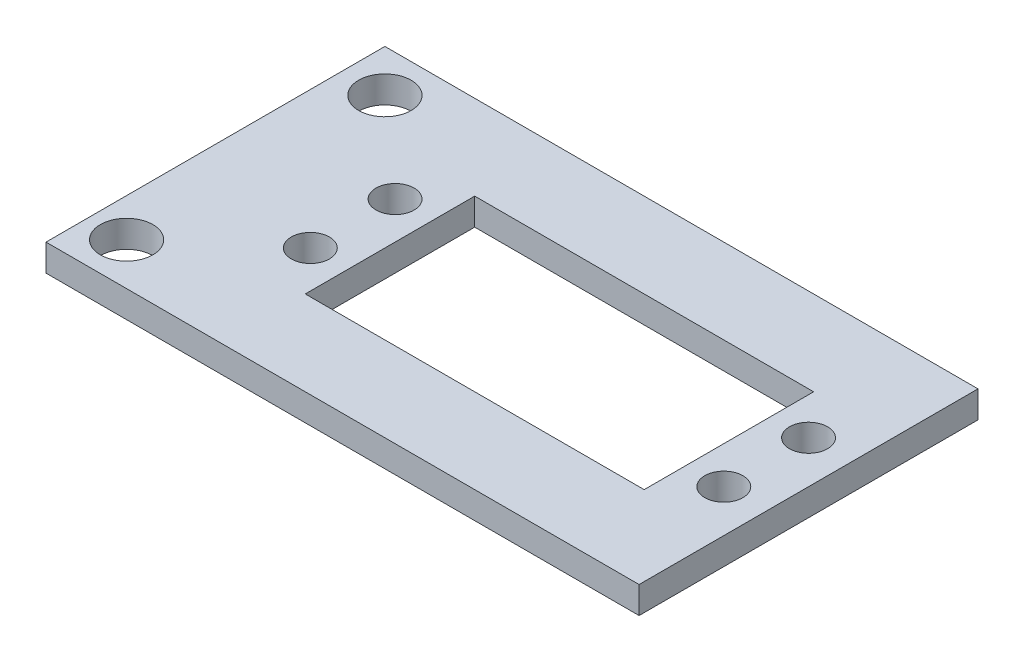
from build123d import *

# Parameters (mm, degrees)
SKETCH1_W           = 70
SKETCH1_H           = 40
SKETCH1_R           = 2.25
SKETCH1_R_2         = 3.1
SKETCH1_W_2         = 40
SKETCH1_H_2         = 20
BOSS_EXTRUDE1_DEPTH = 3.175


with BuildPart() as part:
    # Sketch1 → Boss-Extrude1 (new body)
    with BuildSketch(Plane(origin=(0, 0, 0), x_dir=(1, 0, 0), z_dir=(0, 1, 0))):
        Rectangle(SKETCH1_W, SKETCH1_H)
        with Locations((30, 5)):
            Circle(SKETCH1_R, mode=Mode.SUBTRACT)
        with Locations((-18.8, 5)):
            Circle(SKETCH1_R, mode=Mode.SUBTRACT)
        with Locations((-18.8, -5)):
            Circle(SKETCH1_R, mode=Mode.SUBTRACT)
        with Locations((30, -5)):
            Circle(SKETCH1_R, mode=Mode.SUBTRACT)
        with Locations((-30, 15)):
            Circle(SKETCH1_R_2, mode=Mode.SUBTRACT)
        with Locations((-30.486667072, -15)):
            Circle(SKETCH1_R_2, mode=Mode.SUBTRACT)
        with Locations((5.6, 0)):
            Rectangle(SKETCH1_W_2, SKETCH1_H_2, mode=Mode.SUBTRACT)
    extrude(amount=BOSS_EXTRUDE1_DEPTH)


solid = part.part
